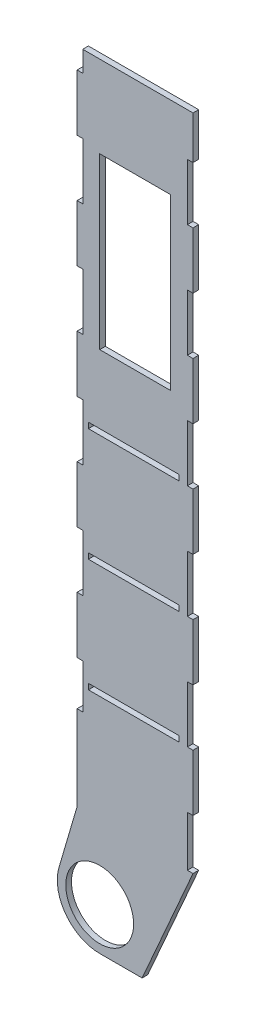
from build123d import *

# Parameters (mm, degrees)
SKETCH_1_R      = 12
SKETCH_1_W      = 32
SKETCH_1_H      = 2
SKETCH_1_W_2    = 25
SKETCH_1_H_2    = 60
EXTRUDE_1_DEPTH = 2


with BuildPart() as part:
    # 草图1 → 凸台-拉伸1 (new body)
    with BuildSketch(Plane.XY):
        with BuildLine():
            Line((-8, -28.342527861), (-8, -48.342527861))
            Line((-8, -48.342527861), (-6, -48.342527861))
            Line((-6, -48.342527861), (-6, -68.342527861))
            Line((-6, -68.342527861), (-8, -68.342527861))
            Line((-8, -68.342527861), (-8, -88.342527861))
            Line((-8, -88.342527861), (-6, -88.342527861))
            Line((-6, -88.342527861), (-6, -108.342527861))
            Line((-6, -108.342527861), (-8, -108.342527861))
            Line((-8, -108.342527861), (-8, -128.342527861))
            Line((-8, -128.342527861), (-6, -128.342527861))
            Line((-6, -128.342527861), (-6, -144.000000011))
            Line((-6, -144.000000011), (-8, -144.000000011))
            Line((-8, -144.000000011), (-8, -174))
            Line((-8, -174), (-14.392579, -195.774639692))
            ThreePointArc((-14.392579, -195.774639692), (-12.007922481, -208.989426995), (0, -215))
            Line((0, -215), (15, -215))
            Line((15, -215), (33, -174))
            Line((33, -174), (31, -174))
            Line((31, -174), (31, -156.221540553))
            Line((31, -156.221540553), (33, -156.221540553))
            Line((33, -156.221540553), (33, -136.221540553))
            Line((33, -136.221540553), (31, -136.221540553))
            Line((31, -136.221540553), (31, -116.221540553))
            Line((31, -116.221540553), (33, -116.221540553))
            Line((33, -116.221540553), (33, -96.221540553))
            Line((33, -96.221540553), (31, -96.221540553))
            Line((31, -96.221540553), (31, -76.221540553))
            Line((31, -76.221540553), (33, -76.221540553))
            Line((33, -76.221540553), (33, -56.221540553))
            Line((33, -56.221540553), (31, -56.221540553))
            Line((31, -56.221540553), (31, -36.221540553))
            Line((31, -36.221540553), (33, -36.221540553))
            Line((33, -36.221540553), (33, -16.221540553))
            Line((33, -16.221540553), (31, -16.221540553))
            Line((31, -16.221540553), (31, 3.778459447))
            Line((31, 3.778459447), (33, 3.778459447))
            Line((33, 3.778459447), (33, 23.778459447))
            Line((33, 23.778459447), (31, 23.778459447))
            Line((31, 23.778459447), (31, 43.778459447))
            Line((31, 43.778459447), (33, 43.778459447))
            Line((33, 43.778459447), (33, 49))
            Line((33, 49), (33, 59))
            Line((33, 59), (-6, 59))
            Line((-6, 59), (-6, 51.657472139))
            Line((-6, 51.657472139), (-8, 51.657472139))
            Line((-8, 51.657472139), (-8, 31.657472139))
            Line((-8, 31.657472139), (-6, 31.657472139))
            Line((-6, 31.657472139), (-6, 11.657472139))
            Line((-6, 11.657472139), (-8, 11.657472139))
            Line((-8, 11.657472139), (-8, -8.342527861))
            Line((-8, -8.342527861), (-6, -8.342527861))
            Line((-6, -8.342527861), (-6, -28.342527861))
            Line((-6, -28.342527861), (-8, -28.342527861))
        make_face()
        with Locations((0, -200)):
            Circle(SKETCH_1_R, mode=Mode.SUBTRACT)
        with Locations((12, -135.221540553)):
            Rectangle(SKETCH_1_W, SKETCH_1_H, mode=Mode.SUBTRACT)
        with Locations((12, -95.221540553)):
            Rectangle(SKETCH_1_W, SKETCH_1_H, mode=Mode.SUBTRACT)
        with Locations((12, -55.221540553)):
            Rectangle(SKETCH_1_W, SKETCH_1_H, mode=Mode.SUBTRACT)
        with Locations((12.5, 0)):
            Rectangle(SKETCH_1_W_2, SKETCH_1_H_2, mode=Mode.SUBTRACT)
    extrude(amount=EXTRUDE_1_DEPTH)


solid = part.part
